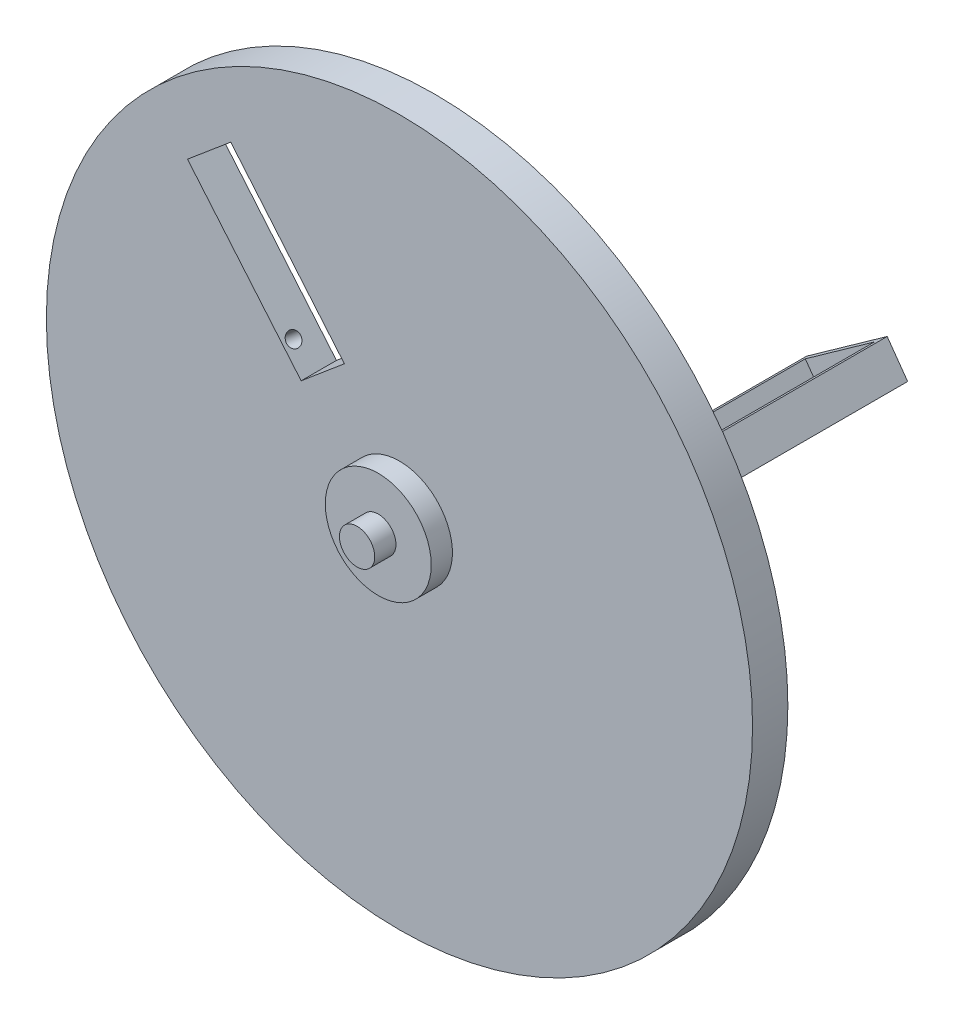
from build123d import *

# Parameters (mm, degrees)
SKETCH1_W               = 100
SKETCH1_H               = 100
BOSS_EXTRUDE1_DEPTH     = 5
SKETCH2_R               = 7.5
BOSS_EXTRUDE2_DEPTH     = 3
SKETCH3_R               = 2.5
BOSS_EXTRUDE3_DEPTH     = 3
CUT_EXTRUDE1_DEPTH      = 71.964779997
CUT_EXTRUDE2_DEPTH      = 12
CUT_EXTRUDE2_DEPTH_BACK = 5
SKETCH11_R              = 1
BOSS_EXTRUDE5_DEPTH     = 27
SHELL1_START            = 5.027136377
SHELL1_DEPTH            = 5
SHELL1_START_2          = -8.972863623
SHELL1_2_DEPTH          = 4
SHELL1_START_3          = 10.027136377
SHELL1_3_DEPTH          = 34.623982156
SHELL1_START_4          = 43.654391787
SHELL1_4_DEPTH          = 0.996726746
SHELL1_START_5          = 30.292722796
SHELL1_5_DEPTH          = 0.404221296
SHELL1_START_6          = 1
SHELL1_6_DEPTH          = 3
SHELL1_START_7          = -26
SHELL1_7_DEPTH          = 27
SHELL1_START_8          = 4
SHELL1_8_OUTLINE_R      = 6.5
SHELL1_8_DEPTH          = 3
SHELL1_START_9          = 7
SHELL1_9_OUTLINE_R      = 1.5
SHELL1_9_DEPTH          = 3
SHELL1_10_DEPTH         = 3
SKETCH14_W              = 105.332153784
SKETCH14_H              = 107.039050792
SKETCH14_R              = 50
CUT_EXTRUDE3_DEPTH      = 76.690157881
BOSS_EXTRUDE6_START     = -5
SKETCH15_R              = 50
SKETCH15_R_2            = 48.20184761
BOSS_EXTRUDE6_DEPTH     = 5
SKETCH16_W              = 2
SKETCH16_H              = 10
BOSS_EXTRUDE7_DEPTH     = 2


with BuildPart() as part:
    # Sketch1 → Boss-Extrude1 (new body)
    with BuildSketch(Plane.XY):
        Rectangle(SKETCH1_W, SKETCH1_H)
    extrude(amount=BOSS_EXTRUDE1_DEPTH)

    # Sketch2 → Boss-Extrude2 (add)
    with BuildSketch(Plane.XY.offset(5)):
        with Locations(Location((0, 0, 0), (0, 0, 180))):
            Circle(SKETCH2_R)
    extrude(amount=BOSS_EXTRUDE2_DEPTH)

    # Sketch3 → Boss-Extrude3 (add)
    with BuildSketch(Plane.XY.offset(8)):
        Circle(SKETCH3_R)
    extrude(amount=BOSS_EXTRUDE3_DEPTH)

    # Sketch10 → Cut-Extrude1 (cut, through all)
    with BuildSketch(Plane.XY.offset(5)):
        Polygon((-7.799279723, 15.528201009), (-13.921426992, 10.378510454), (-30.014209976, 29.510220671), (-23.892062707, 34.659911226), align=None)
    extrude(amount=-CUT_EXTRUDE1_DEPTH, mode=Mode.SUBTRACT)

    # Sketch11 → Cut-Extrude2 (cut, two sides: drawn at the far end of the back side and taken through both)
    with BuildSketch(Plane(origin=(3.081840247, 2.592313271, 0), x_dir=(0, 0, 1), z_dir=(-0.765268408666043, -0.6437113193798463, 0)).offset(-CUT_EXTRUDE2_DEPTH_BACK)):
        with Locations(Location((3.5, 20.903726316, 0), (0, 0, 90))):
            Circle(SKETCH11_R)
    extrude(amount=CUT_EXTRUDE2_DEPTH + CUT_EXTRUDE2_DEPTH_BACK, mode=Mode.SUBTRACT)

    # Sketch13 → Boss-Extrude5 (add)
    with BuildSketch(Plane(origin=(0, 0, 0), x_dir=(-1, 0, 0), z_dir=(0, 0, -1))):
        Polygon((-25.653340805, 17.18977508), (-37.06059478, 25.306089315), (-39.959278435, 21.232070039), (-28.552024461, 13.115755803), align=None)
    extrude(amount=BOSS_EXTRUDE5_DEPTH)

    # Shell1: read off the stored shape, not the designer's step
    # Shell1 outline → Shell1 (cut)
    with BuildSketch(Plane(origin=(0, 0, 0), x_dir=(0.6437113193798459, -0.7652684086660432, 0), z_dir=(0.7652684086660431, 0.6437113193798462, 0)).offset(SHELL1_START)):
        with BuildLine():
            Line((-18.967234643, -4), (-15.903726316, -4))
            Line((-15.903726316, -4), (-15.903726316, -1))
            Line((-15.903726316, -1), (-42.903726316, -1))
            Line((-42.903726316, -1), (-42.903726316, -4))
            Line((-42.903726316, -4), (-22.840217989, -4))
            ThreePointArc((-22.840217989, -4), (-20.903726316, -1.5), (-18.967234643, -4))
        make_face()
    extrude(amount=SHELL1_DEPTH, mode=Mode.SUBTRACT)

    # Shell1 2 outline → Shell1 2 (cut)
    with BuildSketch(Plane(origin=(0, 0, 0), x_dir=(0.6437113193798459, -0.7652684086660432, 0), z_dir=(0.7652684086660431, 0.6437113193798462, 0)).offset(SHELL1_START_2)):
        with BuildLine():
            Line((-18.967234643, -4), (-15.903726316, -4))
            Line((-15.903726316, -4), (-15.903726316, -1))
            Line((-15.903726316, -1), (-42.903726316, -1))
            Line((-42.903726316, -1), (-42.903726316, -4))
            Line((-42.903726316, -4), (-22.840217989, -4))
            ThreePointArc((-22.840217989, -4), (-20.903726316, -1.5), (-18.967234643, -4))
        make_face()
    extrude(amount=SHELL1_2_DEPTH, mode=Mode.SUBTRACT)

    # Shell1 3 outline → Shell1 3 (cut)
    with BuildSketch(Plane(origin=(0, 0, 0), x_dir=(0.6437113193798459, -0.7652684086660432, 0), z_dir=(0.7652684086660431, 0.6437113193798462, 0)).offset(SHELL1_START_3)):
        with BuildLine():
            Line((-22.840217989, -4), (-18.967234643, -4))
            ThreePointArc((-18.967234643, -4), (-20.903726316, -1.5), (-22.840217989, -4))
        make_face()
    extrude(amount=SHELL1_3_DEPTH, mode=Mode.SUBTRACT)

    # Shell1 4 outline → Shell1 4 (cut)
    with BuildSketch(Plane(origin=(0, 0, 0), x_dir=(0.6437113193798459, -0.7652684086660432, 0), z_dir=(0.7652684086660431, 0.6437113193798462, 0)).offset(SHELL1_START_4)):
        with BuildLine():
            Line((-18.967234643, -4), (-15.903726316, -4))
            Line((-15.903726316, -4), (-15.903726316, -1))
            Line((-15.903726316, -1), (-42.903726316, -1))
            Line((-42.903726316, -1), (-42.903726316, -4))
            Line((-42.903726316, -4), (-22.840217989, -4))
            ThreePointArc((-22.840217989, -4), (-20.903726316, -1.5), (-18.967234643, -4))
        make_face()
    extrude(amount=SHELL1_4_DEPTH, mode=Mode.SUBTRACT)

    # Shell1 5 outline → Shell1 5 (cut)
    with BuildSketch(Plane(origin=(0, 0, 0), x_dir=(0.6437113193798459, -0.7652684086660432, 0), z_dir=(0.7652684086660431, 0.6437113193798462, 0)).offset(SHELL1_START_5)):
        with BuildLine():
            Line((-18.967234643, -4), (-15.903726316, -4))
            Line((-15.903726316, -4), (-15.903726316, -1))
            Line((-15.903726316, -1), (-42.903726316, -1))
            Line((-42.903726316, -1), (-42.903726316, -4))
            Line((-42.903726316, -4), (-22.840217989, -4))
            ThreePointArc((-22.840217989, -4), (-20.903726316, -1.5), (-18.967234643, -4))
        make_face()
    extrude(amount=SHELL1_5_DEPTH, mode=Mode.SUBTRACT)

    # Shell1 6 outline → Shell1 6 (cut)
    with BuildSketch(Plane.XY.offset(SHELL1_START_6)):
        Polygon((49, -49), (49, 49), (17.13028231, 49), (23.932681775, 40.913049752), (23.169918284, 40.271445464), (15.827828511, 49), (-1.10407087, 49), (13.253992906, 31.930589712), (12.944655118, 31.670387888), (-1.632279393, 49), (-49, 49), (-49, -49), align=None)
        Polygon((-2.563957951, 18.625200517), (-6.390299995, 15.40664392), (-14.042984081, 8.969530726), (-17.104057716, 6.394685448), (-19.035191674, 8.690490674), (-21.610036952, 11.751564309), (-34.484263339, 27.056932482), (-31.423189704, 29.63177776), (-23.770505618, 36.068890954), (-19.944163574, 39.287447551), align=None, mode=Mode.SUBTRACT)
    extrude(amount=SHELL1_6_DEPTH, mode=Mode.SUBTRACT)

    # Shell1 7 outline → Shell1 7 (cut)
    with BuildSketch(Plane.XY.offset(SHELL1_START_7)):
        Polygon((36.245790924, 24.726352584), (26.46814466, 17.769511811), (29.366828316, 13.695492535), (39.14447458, 20.652333308), align=None)
    extrude(amount=SHELL1_7_DEPTH, mode=Mode.SUBTRACT)

    # Shell1 8 outline → Shell1 8 (cut)
    with BuildSketch(Plane.XY.offset(SHELL1_START_8)):
        Circle(SHELL1_8_OUTLINE_R)
    extrude(amount=SHELL1_8_DEPTH, mode=Mode.SUBTRACT)

    # Shell1 9 outline → Shell1 9 (cut)
    with BuildSketch(Plane.XY.offset(SHELL1_START_9)):
        Circle(SHELL1_9_OUTLINE_R)
    extrude(amount=SHELL1_9_DEPTH, mode=Mode.SUBTRACT)

    # Shell1 10 outline → Shell1 10 (add)
    with BuildSketch(Plane.XY.offset(SHELL1_START_6)):
        Polygon((15.827828511, 49), (17.13028231, 49), (16.289124734, 50), (14.986670935, 50), align=None)
        Polygon((-1.632279393, 49), (-1.10407087, 49), (-1.945228446, 50), (-2.473436969, 50), align=None)
    extrude(amount=SHELL1_10_DEPTH)

    # Sketch14 → Cut-Extrude3 (cut, through all)
    with BuildSketch(Plane(origin=(0, 0, 0), x_dir=(-1, 0, 0), z_dir=(0, 0, -1))):
        Rectangle(SKETCH14_W, SKETCH14_H)
        Circle(SKETCH14_R, mode=Mode.SUBTRACT)
    extrude(amount=-CUT_EXTRUDE3_DEPTH, mode=Mode.SUBTRACT)

    # Sketch15 → Boss-Extrude6 (add)
    with BuildSketch(Plane.XY.offset(5).offset(BOSS_EXTRUDE6_START)):
        with Locations(Location((0, 0, 0), (0, 0, 180))):
            Circle(SKETCH15_R)
        with Locations(Location((0, 0, 0), (0, 0, 180))):
            Circle(SKETCH15_R_2, mode=Mode.SUBTRACT)
    extrude(amount=BOSS_EXTRUDE6_DEPTH)

    # Sketch16 → Boss-Extrude7 (add)
    with BuildSketch(Plane(origin=(0, 0, 0), x_dir=(-1, 0, 0), z_dir=(0, 0, -1))):
        with Locations((25, 0)):
            Rectangle(SKETCH16_W, SKETCH16_H)
    extrude(amount=BOSS_EXTRUDE7_DEPTH)


solid = part.part
